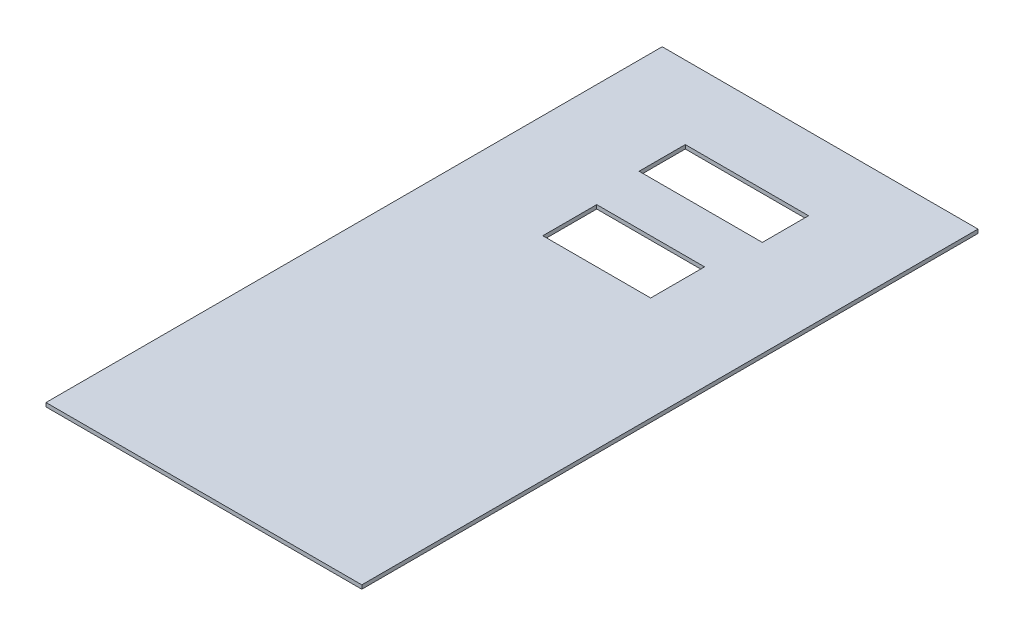
from build123d import *

# Parameters (mm, degrees)
SKETCH_1_W      = 82
SKETCH_1_H      = 160
SKETCH_1_W_2    = 32
SKETCH_1_H_2    = 12
EXTRUDE_1_DEPTH = 1


with BuildPart() as part:
    # 草图1 → 凸台-拉伸1 (new body)
    with BuildSketch(Plane(origin=(0, 0, 0), x_dir=(1, 0, 0), z_dir=(0, 1, 0))):
        Rectangle(SKETCH_1_W, SKETCH_1_H)
        Polygon((0, 22), (14, 22), (14, 36), (-14, 36), (-14, 22), align=None, mode=Mode.SUBTRACT)
        with Locations((0, 55)):
            Rectangle(SKETCH_1_W_2, SKETCH_1_H_2, mode=Mode.SUBTRACT)
    extrude(amount=EXTRUDE_1_DEPTH)


solid = part.part
